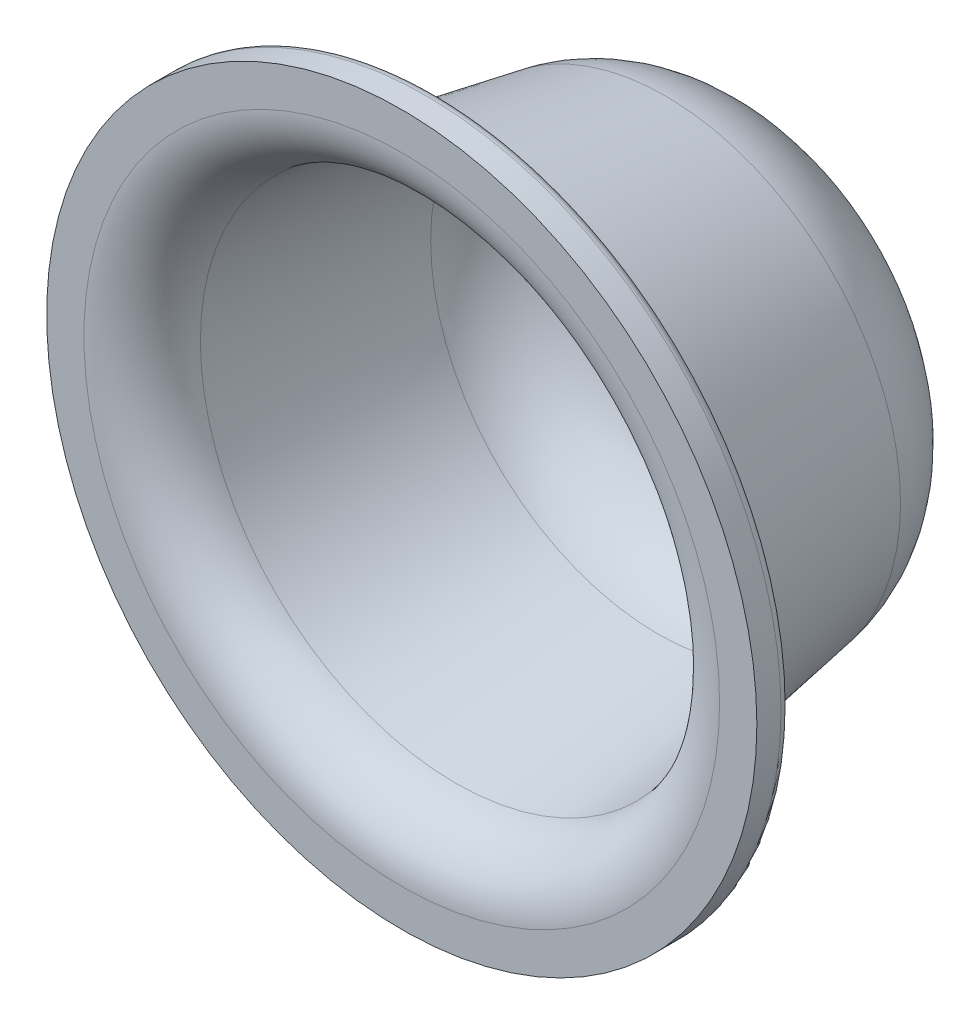
from build123d import *


with BuildPart() as part:
    # Sketch1 → Revolve1 (revolve)
    with BuildSketch(Plane(origin=(0, 0, 0), x_dir=(0, 0, -1), z_dir=(1, 0, 0))):
        with BuildLine():
            Line((0, 50), (3.4, 50))
            ThreePointArc((3.4, 50), (4.8, 48.6), (3.4, 47.2))
            Line((3.4, 47.2), (3.2, 47.2))
            ThreePointArc((3.2, 47.2), (2.492893219, 46.907106781), (2.2, 46.2))
            Line((2.2, 46.2), (2.2, 44.3))
            ThreePointArc((2.2, 44.3), (3.603733341, 40.443274342), (7.158110934, 38.391153482))
            Line((7.158110934, 38.391153482), (37.125667198, 33.107064767))
            ThreePointArc((37.125667198, 33.107064767), (47.788799976, 26.950702187), (52, 15.380525212))
            Line((52, 15.380525212), (52, 0))
            Line((52, 0), (48.15, 0))
            Line((48.15, 0), (48.15, 18.15))
            ThreePointArc((48.15, 18.15), (44.711147764, 27.340329586), (36.083977442, 32.015775537))
            Line((36.083977442, 32.015775537), (7.627449974, 35.984849035))
            ThreePointArc((7.627449974, 35.984849035), (2.173845878, 38.940398797), (0, 44.75))
            Line((0, 44.75), (0, 50))
        make_face()
    revolve(axis=Axis((0, 0, 0), (0, 0, -1)))


solid = part.part
